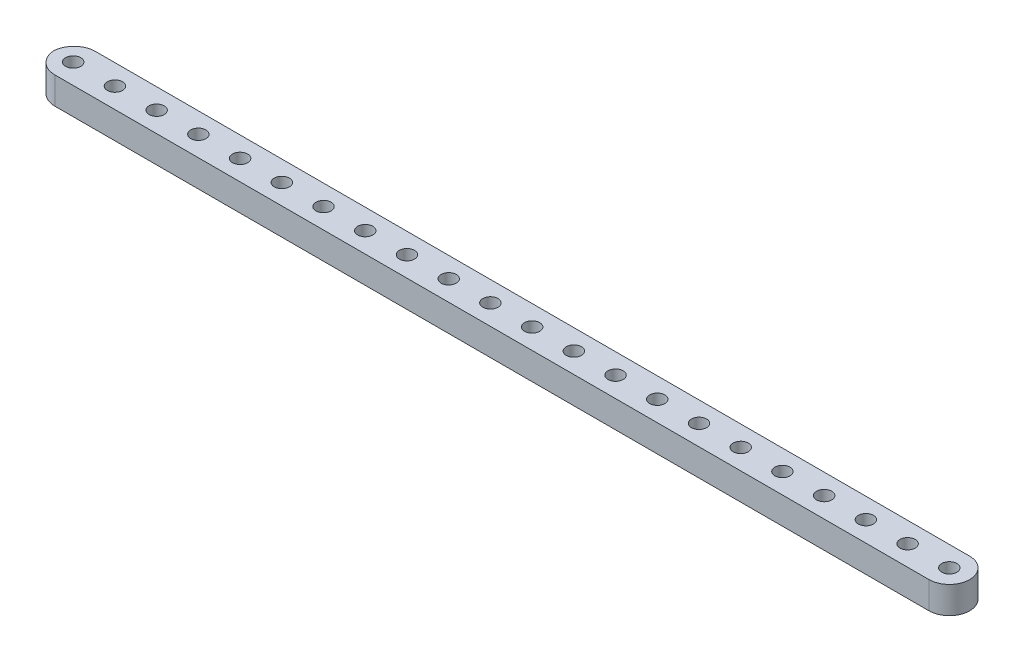
from build123d import *

# Parameters (mm, degrees)
SKETCH1_R           = 1.778
BOSS_EXTRUDE1_DEPTH = 6.35
SKETCH2_W           = 107.95
SKETCH2_H           = 43.961626997
CUT_EXTRUDE1_DEPTH  = 12.7
FILLET1_R           = 5.08


with BuildPart() as part:
    # Sketch1 → Boss-Extrude1 (new body)
    with BuildSketch(Plane(origin=(0, 6.35, 0), x_dir=(1, 0, 0), z_dir=(0, 1, 0))):
        with BuildLine():
            Line((156.464, 4.7625), (-156.464, 4.7625))
            ThreePointArc((-156.464, 4.7625), (-161.2265, 0), (-156.464, -4.7625))
            Line((-156.464, -4.7625), (156.464, -4.7625))
            ThreePointArc((156.464, -4.7625), (161.2265, 0), (156.464, 4.7625))
        make_face()
        with Locations(Location((156.464, 0, 0), (0, 0, 270))):
            Circle(SKETCH1_R, mode=Mode.SUBTRACT)
        with Locations(Location((146.685, 0, 0), (0, 0, 270))):
            Circle(SKETCH1_R, mode=Mode.SUBTRACT)
        with Locations(Location((136.906, 0, 0), (0, 0, 270))):
            Circle(SKETCH1_R, mode=Mode.SUBTRACT)
        with Locations(Location((127.127, 0, 0), (0, 0, 270))):
            Circle(SKETCH1_R, mode=Mode.SUBTRACT)
        with Locations(Location((117.348, 0, 0), (0, 0, 270))):
            Circle(SKETCH1_R, mode=Mode.SUBTRACT)
        with Locations(Location((107.569, 0, 0), (0, 0, 270))):
            Circle(SKETCH1_R, mode=Mode.SUBTRACT)
        with Locations(Location((97.79, 0, 0), (0, 0, 270))):
            Circle(SKETCH1_R, mode=Mode.SUBTRACT)
        with Locations(Location((88.011, 0, 0), (0, 0, 270))):
            Circle(SKETCH1_R, mode=Mode.SUBTRACT)
        with Locations(Location((78.232, 0, 0), (0, 0, 270))):
            Circle(SKETCH1_R, mode=Mode.SUBTRACT)
        with Locations(Location((68.453, 0, 0), (0, 0, 270))):
            Circle(SKETCH1_R, mode=Mode.SUBTRACT)
        with Locations(Location((58.674, 0, 0), (0, 0, 270))):
            Circle(SKETCH1_R, mode=Mode.SUBTRACT)
        with Locations(Location((48.895, 0, 0), (0, 0, 270))):
            Circle(SKETCH1_R, mode=Mode.SUBTRACT)
        with Locations(Location((39.116, 0, 0), (0, 0, 270))):
            Circle(SKETCH1_R, mode=Mode.SUBTRACT)
        with Locations(Location((29.337, 0, 0), (0, 0, 270))):
            Circle(SKETCH1_R, mode=Mode.SUBTRACT)
        with Locations(Location((19.558, 0, 0), (0, 0, 270))):
            Circle(SKETCH1_R, mode=Mode.SUBTRACT)
        with Locations(Location((9.779, 0, 0), (0, 0, 270))):
            Circle(SKETCH1_R, mode=Mode.SUBTRACT)
        with Locations(Location((0, 0, 0), (0, 0, 270))):
            Circle(SKETCH1_R, mode=Mode.SUBTRACT)
        with Locations(Location((-9.779, 0, 0), (0, 0, 270))):
            Circle(SKETCH1_R, mode=Mode.SUBTRACT)
        with Locations(Location((-19.558, 0, 0), (0, 0, 270))):
            Circle(SKETCH1_R, mode=Mode.SUBTRACT)
        with Locations(Location((-29.337, 0, 0), (0, 0, 270))):
            Circle(SKETCH1_R, mode=Mode.SUBTRACT)
        with Locations(Location((-39.116, 0, 0), (0, 0, 270))):
            Circle(SKETCH1_R, mode=Mode.SUBTRACT)
        with Locations(Location((-48.895, 0, 0), (0, 0, 270))):
            Circle(SKETCH1_R, mode=Mode.SUBTRACT)
        with Locations(Location((-58.674, 0, 0), (0, 0, 270))):
            Circle(SKETCH1_R, mode=Mode.SUBTRACT)
        with Locations(Location((-68.453, 0, 0), (0, 0, 270))):
            Circle(SKETCH1_R, mode=Mode.SUBTRACT)
        with Locations(Location((-78.232, 0, 0), (0, 0, 270))):
            Circle(SKETCH1_R, mode=Mode.SUBTRACT)
        with Locations(Location((-88.011, 0, 0), (0, 0, 270))):
            Circle(SKETCH1_R, mode=Mode.SUBTRACT)
        with Locations(Location((-97.79, 0, 0), (0, 0, 270))):
            Circle(SKETCH1_R, mode=Mode.SUBTRACT)
        with Locations(Location((-107.569, 0, 0), (0, 0, 270))):
            Circle(SKETCH1_R, mode=Mode.SUBTRACT)
        with Locations(Location((-117.348, 0, 0), (0, 0, 270))):
            Circle(SKETCH1_R, mode=Mode.SUBTRACT)
        with Locations(Location((-127.127, 0, 0), (0, 0, 270))):
            Circle(SKETCH1_R, mode=Mode.SUBTRACT)
        with Locations(Location((-136.906, 0, 0), (0, 0, 270))):
            Circle(SKETCH1_R, mode=Mode.SUBTRACT)
        with Locations(Location((-146.685, 0, 0), (0, 0, 270))):
            Circle(SKETCH1_R, mode=Mode.SUBTRACT)
        with Locations(Location((-156.464, 0, 0), (0, 0, 270))):
            Circle(SKETCH1_R, mode=Mode.SUBTRACT)
    extrude(amount=-BOSS_EXTRUDE1_DEPTH)

    # Sketch2 → Cut-Extrude1 (cut)
    with BuildSketch(Plane(origin=(0, 6.35, 0), x_dir=(1, 0, 0), z_dir=(0, 1, 0))):
        with Locations((-107.462342395, 7.140474726)):
            Rectangle(SKETCH2_W, SKETCH2_H)
    extrude(amount=-CUT_EXTRUDE1_DEPTH, mode=Mode.SUBTRACT)

    # Fillet1
    # the kernel refuses this fillet: 5.08 mm, written as the material it takes off along each edge
    with BuildSketch(Plane(origin=(-53.487342395, -12.7, 4.7625), x_dir=(0, 0, -1), z_dir=(0, 1, 0))) as fillet1_piece_1:
        with BuildLine():
            CenterArc((FILLET1_R, -FILLET1_R), FILLET1_R, 90, 90)
            Line((0, -FILLET1_R), (0, 0))
            Line((0, 0), (FILLET1_R, 0))
        make_face()
    extrude(amount=31.75, mode=Mode.SUBTRACT)
    with BuildSketch(Plane(origin=(-53.487342395, 19.05, -4.7625), x_dir=(1, 0, 0), z_dir=(0, -1, 0))) as fillet1_piece_2:
        with BuildLine():
            CenterArc((FILLET1_R, FILLET1_R), FILLET1_R, 180, 90)
            Line((0, FILLET1_R), (0, 0))
            Line((0, 0), (FILLET1_R, 0))
        make_face()
    extrude(amount=31.75, mode=Mode.SUBTRACT)


solid = part.part
